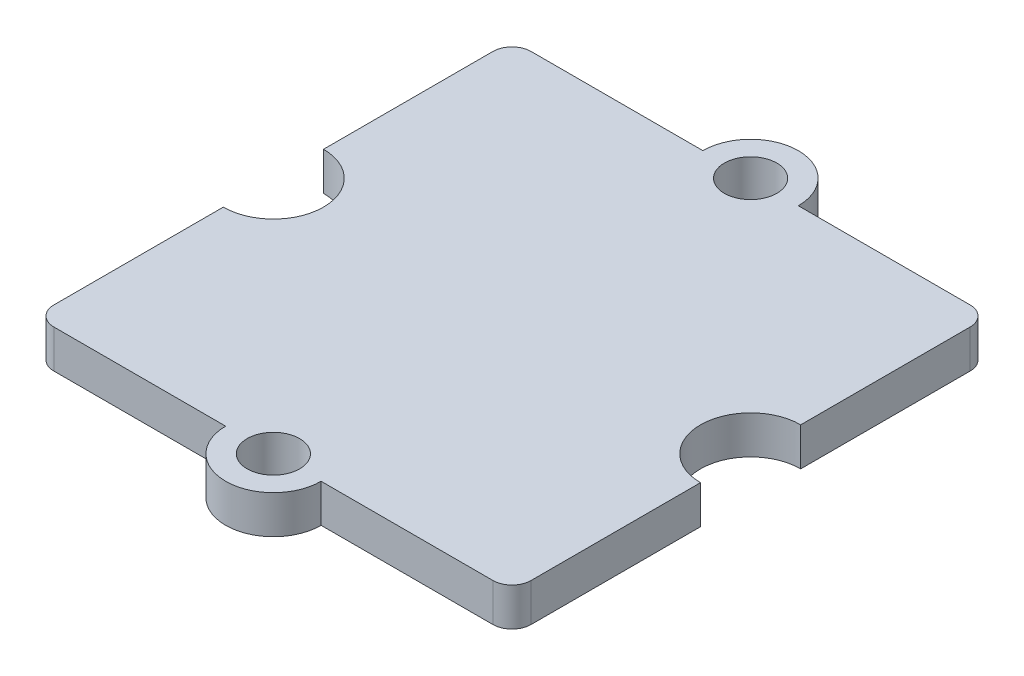
from build123d import *

# Parameters (mm, degrees)
ESQUISSE1_R        = 1.1
BOSS_EXTRU_1_DEPTH = 0.8


with BuildPart() as part:
    # Esquisse1 → Boss.-Extru.1 (new, symmetric)
    with BuildSketch(Plane(origin=(0, 0, 0), x_dir=(1, 0, 0), z_dir=(0, 1, 0))):
        with BuildLine():
            ThreePointArc((-2, -10), (0, -12), (2, -10))
            Line((2, -10), (9.2, -10))
            ThreePointArc((9.2, -10), (9.765685425, -9.765685425), (10, -9.2))
            Line((10, -9.2), (10, -2.1))
            ThreePointArc((10, -2.1), (7.9, 0), (10, 2.1))
            Line((10, 2.1), (10, 9.2))
            ThreePointArc((10, 9.2), (9.765685425, 9.765685425), (9.2, 10))
            Line((9.2, 10), (2, 10))
            ThreePointArc((2, 10), (0, 12), (-2, 10))
            Line((-2, 10), (-9.2, 10))
            ThreePointArc((-9.2, 10), (-9.765685425, 9.765685425), (-10, 9.2))
            Line((-10, 9.2), (-10, 2.1))
            ThreePointArc((-10, 2.1), (-7.9, 0), (-10, -2.1))
            Line((-10, -2.1), (-10, -9.2))
            ThreePointArc((-10, -9.2), (-9.765685425, -9.765685425), (-9.2, -10))
            Line((-9.2, -10), (-2, -10))
        make_face()
        with Locations((0, -10)):
            Circle(ESQUISSE1_R, mode=Mode.SUBTRACT)
        with Locations((0, 10)):
            Circle(ESQUISSE1_R, mode=Mode.SUBTRACT)
    extrude(amount=BOSS_EXTRU_1_DEPTH, both=True)


solid = part.part
